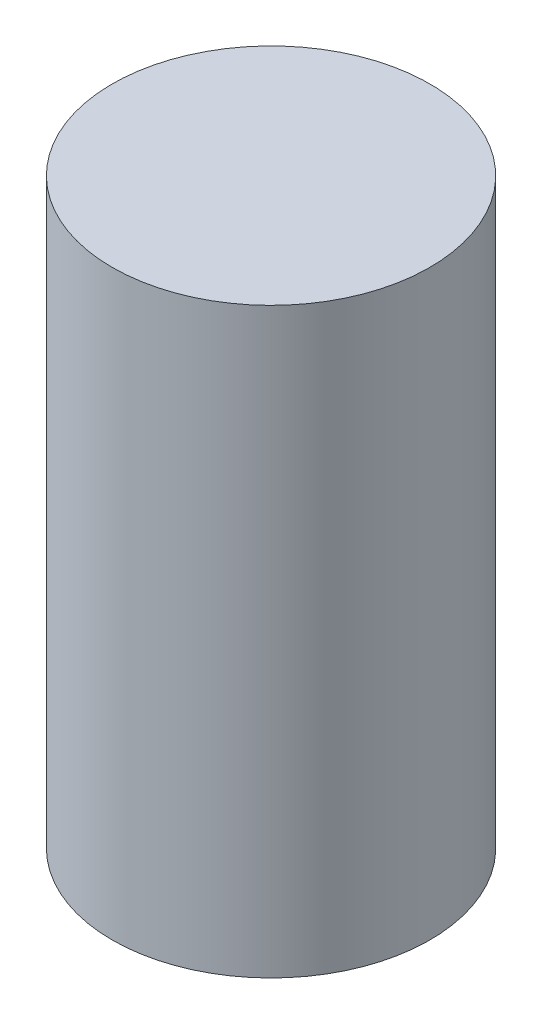
from build123d import *

# Parameters (mm, degrees)
EXTRUDE_1_DEPTH      = 1000
EXTRUDE_1_DEPTH_BACK = 100
SKETCH_2_R           = 300


with BuildPart() as part:
    # 草图2 → 凸台-拉伸1 (new, two sides: drawn at the far end of the back side and taken through both)
    with BuildSketch(Plane(origin=(0, 0, 0), x_dir=(1, 0, 0), z_dir=(0, 1, 0)).offset(-EXTRUDE_1_DEPTH_BACK)):
        Circle(SKETCH_2_R)
    extrude(amount=EXTRUDE_1_DEPTH + EXTRUDE_1_DEPTH_BACK)


solid = part.part
